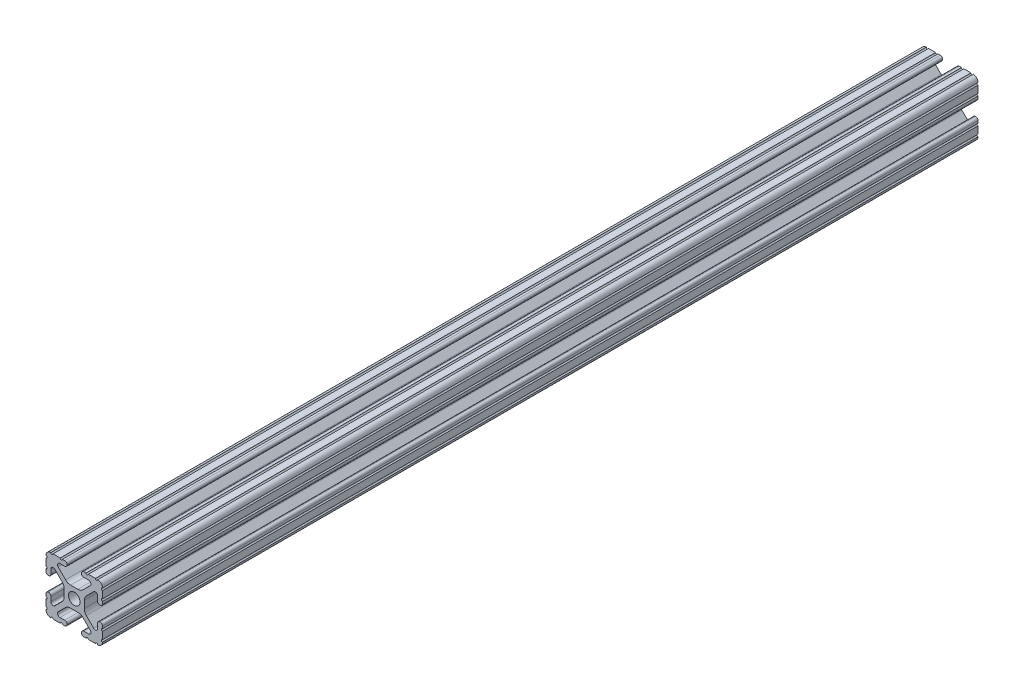
from build123d import *

# Parameters (mm, degrees)
SKETCH1_R      = 2.6035
EXTRUDE1_DEPTH = 393.7


with BuildPart() as part:
    # Sketch1 → Extrude1 (new body)
    with BuildSketch(Plane.XY):
        with BuildLine():
            Line((-7.207036008, 8.724370562), (-3.898272566, 5.423169045))
            ThreePointArc((-3.898272566, 5.423169045), (-2.869120213, 4.736787962), (-1.655778399, 4.4958))
            Line((-1.655778399, 4.4958), (1.655778399, 4.4958))
            ThreePointArc((1.655778399, 4.4958), (2.869120213, 4.736787962), (3.898272566, 5.423169045))
            Line((3.898272566, 5.423169045), (7.207036008, 8.724370562))
            ThreePointArc((7.207036008, 8.724370562), (7.432222385, 9.85140422), (6.476788598, 10.4902))
            Line((6.476788598, 10.4902), (4.287512407, 10.4902))
            ThreePointArc((4.287512407, 10.4902), (3.54574862, 10.79744862), (3.2385, 11.539212407))
            Line((3.2385, 11.539212407), (3.2385, 11.650987593))
            ThreePointArc((3.2385, 11.650987593), (3.54574862, 12.39275138), (4.287512407, 12.7))
            Line((4.287512407, 12.7), (5.317126718, 12.7))
            ThreePointArc((5.317126718, 12.7), (5.825126718, 12.192), (6.333126718, 12.7))
            Line((6.333126718, 12.7), (9.550443118, 12.7))
            ThreePointArc((9.550443118, 12.7), (10.058366869, 12.192000006), (10.566443095, 12.699847501))
            ThreePointArc((10.566443095, 12.699847501), (12.082537762, 12.08250727), (12.699846982, 10.566399977))
            ThreePointArc((12.699846982, 10.566399977), (12.192000006, 10.058323491), (12.7, 9.5504))
            Line((12.7, 9.5504), (12.7, 6.3330836))
            ThreePointArc((12.7, 6.3330836), (12.192, 5.8250836), (12.7, 5.3170836))
            Line((12.7, 5.3170836), (12.7, 4.287469289))
            ThreePointArc((12.7, 4.287469289), (12.39275138, 3.545705502), (11.650987593, 3.238456882))
            Line((11.650987593, 3.238456882), (11.539212407, 3.238456882))
            ThreePointArc((11.539212407, 3.238456882), (10.79744862, 3.545705502), (10.4902, 4.287469289))
            Line((10.4902, 4.287469289), (10.4902, 6.402089023))
            ThreePointArc((10.4902, 6.402089023), (9.856505071, 7.351067942), (8.737131347, 7.129408934))
            Line((8.737131347, 7.129408934), (5.441005833, 3.840816462))
            ThreePointArc((5.441005833, 3.840816462), (4.750877967, 2.809883091), (4.5085, 1.593185507))
            Line((4.5085, 1.593185507), (4.5085, -1.593185507))
            ThreePointArc((4.5085, -1.593185507), (4.750877967, -2.809883091), (5.441005833, -3.840816462))
            Line((5.441005833, -3.840816462), (8.737131347, -7.129408934))
            ThreePointArc((8.737131347, -7.129408934), (9.856505071, -7.351067942), (10.4902, -6.402089023))
            Line((10.4902, -6.402089023), (10.4902, -4.287469289))
            ThreePointArc((10.4902, -4.287469289), (10.79744862, -3.545705502), (11.539212407, -3.238456882))
            Line((11.539212407, -3.238456882), (11.650987593, -3.238456882))
            ThreePointArc((11.650987593, -3.238456882), (12.39275138, -3.545705502), (12.7, -4.287469289))
            Line((12.7, -4.287469289), (12.7, -5.3170836))
            ThreePointArc((12.7, -5.3170836), (12.192, -5.8250836), (12.7, -6.3330836))
            Line((12.7, -6.3330836), (12.7, -9.5504))
            ThreePointArc((12.7, -9.5504), (12.192000006, -10.058323491), (12.699846982, -10.566399977))
            ThreePointArc((12.699846982, -10.566399977), (12.082537762, -12.08250727), (10.566443095, -12.699847501))
            ThreePointArc((10.566443095, -12.699847501), (10.058366869, -12.192000006), (9.550443118, -12.7))
            Line((9.550443118, -12.7), (6.333126718, -12.7))
            ThreePointArc((6.333126718, -12.7), (5.825126718, -12.192), (5.317126718, -12.7))
            Line((5.317126718, -12.7), (4.287512407, -12.7))
            ThreePointArc((4.287512407, -12.7), (3.54574862, -12.39275138), (3.2385, -11.650987593))
            Line((3.2385, -11.650987593), (3.2385, -11.539212407))
            ThreePointArc((3.2385, -11.539212407), (3.54574862, -10.79744862), (4.287512407, -10.4902))
            Line((4.287512407, -10.4902), (6.416408329, -10.4902))
            ThreePointArc((6.416408329, -10.4902), (7.41473083, -9.822813117), (7.179650497, -8.645192506))
            Line((7.179650497, -8.645192506), (3.952270251, -5.423690499))
            ThreePointArc((3.952270251, -5.423690499), (2.922936451, -4.736929036), (1.709253557, -4.4958))
            Line((1.709253557, -4.4958), (-1.709253557, -4.4958))
            ThreePointArc((-1.709253557, -4.4958), (-2.922936451, -4.736929036), (-3.952270251, -5.423690499))
            Line((-3.952270251, -5.423690499), (-7.179650497, -8.645192506))
            ThreePointArc((-7.179650497, -8.645192506), (-7.41473083, -9.822813117), (-6.416408329, -10.4902))
            Line((-6.416408329, -10.4902), (-4.287512407, -10.4902))
            ThreePointArc((-4.287512407, -10.4902), (-3.54574862, -10.79744862), (-3.2385, -11.539212407))
            Line((-3.2385, -11.539212407), (-3.2385, -11.650987593))
            ThreePointArc((-3.2385, -11.650987593), (-3.54574862, -12.39275138), (-4.287512407, -12.7))
            Line((-4.287512407, -12.7), (-5.317126718, -12.7))
            ThreePointArc((-5.317126718, -12.7), (-5.825126718, -12.192), (-6.333126718, -12.7))
            Line((-6.333126718, -12.7), (-9.550443118, -12.7))
            ThreePointArc((-9.550443118, -12.7), (-10.058366869, -12.192000006), (-10.566443095, -12.699847501))
            ThreePointArc((-10.566443095, -12.699847501), (-12.082537762, -12.08250727), (-12.699846982, -10.566399977))
            ThreePointArc((-12.699846982, -10.566399977), (-12.192000006, -10.058323491), (-12.7, -9.5504))
            Line((-12.7, -9.5504), (-12.7, -6.3330836))
            ThreePointArc((-12.7, -6.3330836), (-12.192, -5.8250836), (-12.7, -5.3170836))
            Line((-12.7, -5.3170836), (-12.7, -4.287469289))
            ThreePointArc((-12.7, -4.287469289), (-12.39275138, -3.545705502), (-11.650987593, -3.238456882))
            Line((-11.650987593, -3.238456882), (-11.539212407, -3.238456882))
            ThreePointArc((-11.539212407, -3.238456882), (-10.79744862, -3.545705502), (-10.4902, -4.287469289))
            Line((-10.4902, -4.287469289), (-10.4902, -6.402089023))
            ThreePointArc((-10.4902, -6.402089023), (-9.856505071, -7.351067942), (-8.737131347, -7.129408934))
            Line((-8.737131347, -7.129408934), (-5.441005833, -3.840816462))
            ThreePointArc((-5.441005833, -3.840816462), (-4.750877967, -2.809883091), (-4.5085, -1.593185507))
            Line((-4.5085, -1.593185507), (-4.5085, 1.593185507))
            ThreePointArc((-4.5085, 1.593185507), (-4.750877967, 2.809883091), (-5.441005833, 3.840816462))
            Line((-5.441005833, 3.840816462), (-8.737131347, 7.129408934))
            ThreePointArc((-8.737131347, 7.129408934), (-9.856505071, 7.351067942), (-10.4902, 6.402089023))
            Line((-10.4902, 6.402089023), (-10.4902, 4.287469289))
            ThreePointArc((-10.4902, 4.287469289), (-10.79744862, 3.545705502), (-11.539212407, 3.238456882))
            Line((-11.539212407, 3.238456882), (-11.650987593, 3.238456882))
            ThreePointArc((-11.650987593, 3.238456882), (-12.39275138, 3.545705502), (-12.7, 4.287469289))
            Line((-12.7, 4.287469289), (-12.7, 5.3170836))
            ThreePointArc((-12.7, 5.3170836), (-12.192, 5.8250836), (-12.7, 6.3330836))
            Line((-12.7, 6.3330836), (-12.7, 9.5504))
            ThreePointArc((-12.7, 9.5504), (-12.192000006, 10.058323491), (-12.699846982, 10.566399977))
            ThreePointArc((-12.699846982, 10.566399977), (-12.082537762, 12.08250727), (-10.566443095, 12.699847501))
            ThreePointArc((-10.566443095, 12.699847501), (-10.058366869, 12.192000006), (-9.550443118, 12.7))
            Line((-9.550443118, 12.7), (-6.333126718, 12.7))
            ThreePointArc((-6.333126718, 12.7), (-5.825126718, 12.192), (-5.317126718, 12.7))
            Line((-5.317126718, 12.7), (-4.287512407, 12.7))
            ThreePointArc((-4.287512407, 12.7), (-3.54574862, 12.39275138), (-3.2385, 11.650987593))
            Line((-3.2385, 11.650987593), (-3.2385, 11.539212407))
            ThreePointArc((-3.2385, 11.539212407), (-3.54574862, 10.79744862), (-4.287512407, 10.4902))
            Line((-4.287512407, 10.4902), (-6.476788598, 10.4902))
            ThreePointArc((-6.476788598, 10.4902), (-7.432222385, 9.85140422), (-7.207036008, 8.724370562))
        make_face()
        Circle(SKETCH1_R, mode=Mode.SUBTRACT)
    extrude(amount=-EXTRUDE1_DEPTH)


solid = part.part
